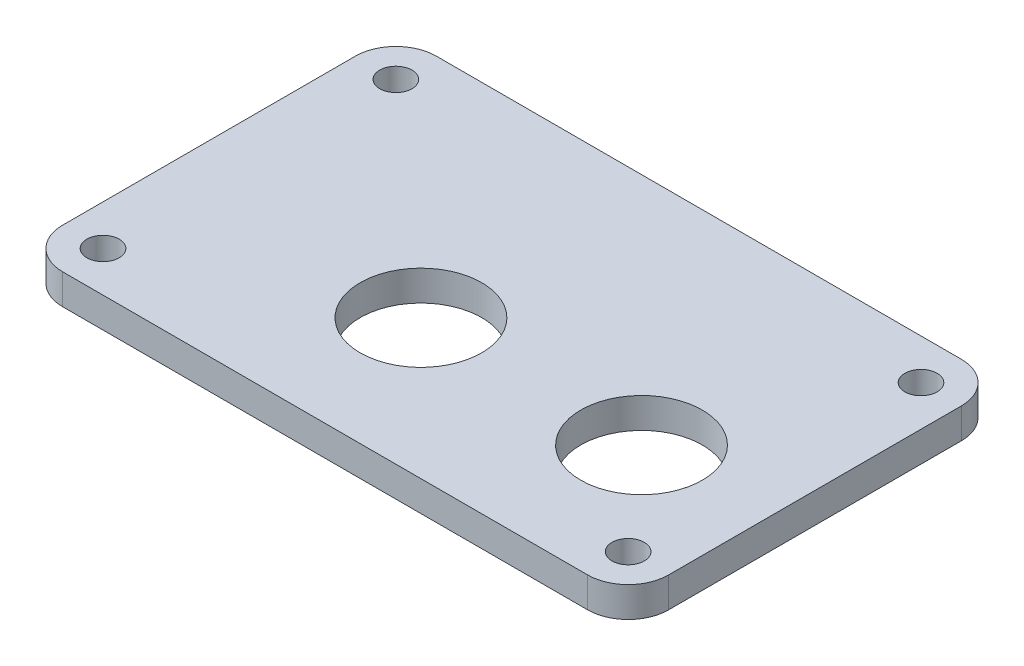
from build123d import *

# Parameters (mm, degrees)
SKETCH1_W           = 60
SKETCH1_H           = 37
BOSS_EXTRUDE1_DEPTH = 2.9972
FILLET1_R           = 4
SKETCH2_R           = 1.6
CUT_EXTRUDE1_DEPTH  = 36.372774952
SKETCH3_R           = 6.0198
CUT_EXTRUDE2_DEPTH  = 36.372774952


with BuildPart() as part:
    # Sketch1 → Boss-Extrude1 (new body)
    with BuildSketch(Plane(origin=(0, 0, 0), x_dir=(1, 0, 0), z_dir=(0, 1, 0))):
        Rectangle(SKETCH1_W, SKETCH1_H)
    extrude(amount=BOSS_EXTRUDE1_DEPTH)

    # Fillet1
    fillet1_edges = [part.edges().sort_by_distance(p)[0] for p in [
        (-30, 1.4986, -18.5),
        (30, 1.4986, -18.5),
        (30, 1.4986, 18.5),
        (-30, 1.4986, 18.5),
    ]]
    fillet(fillet1_edges, radius=FILLET1_R)

    # Sketch2 → Cut-Extrude1 (cut, through all)
    with BuildSketch(Plane(origin=(0, 2.9972, 0), x_dir=(1, 0, 0), z_dir=(0, 1, 0))):
        with Locations((-26, 14.5)):
            Circle(SKETCH2_R)
        with Locations((-26, -14.5)):
            Circle(SKETCH2_R)
        with Locations((26, -14.5)):
            Circle(SKETCH2_R)
        with Locations((26, 14.5)):
            Circle(SKETCH2_R)
    extrude(amount=-CUT_EXTRUDE1_DEPTH, mode=Mode.SUBTRACT)

    # Sketch3 → Cut-Extrude2 (cut, through all)
    with BuildSketch(Plane(origin=(0, 2.9972, 0), x_dir=(1, 0, 0), z_dir=(0, 1, 0))):
        with Locations((-4.318, -4.699)):
            Circle(SKETCH3_R)
        with Locations((17.526, -4.699)):
            Circle(SKETCH3_R)
    extrude(amount=-CUT_EXTRUDE2_DEPTH, mode=Mode.SUBTRACT)


solid = part.part
